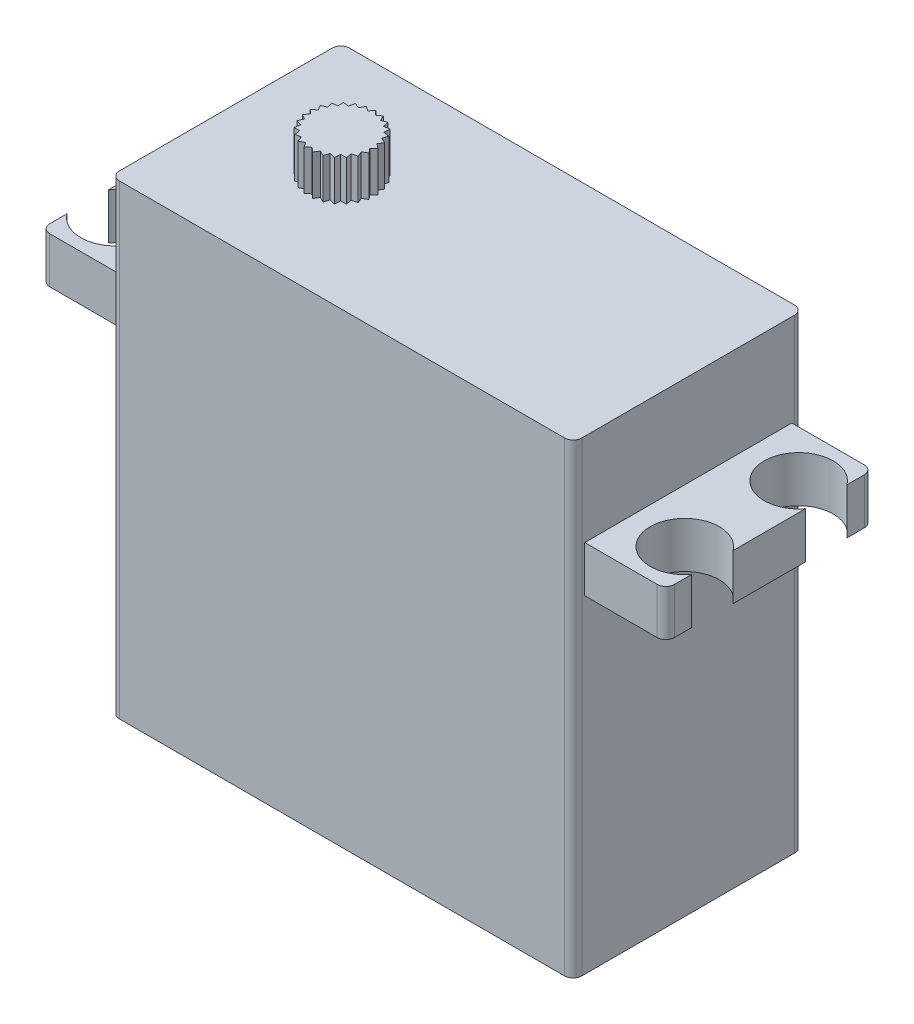
from build123d import *

# Parameters (mm, degrees)
SKETCH1_W           = 40.2
SKETCH1_H           = 20
BOSS_EXTRUDE1_DEPTH = 40.5
SKETCH2_W           = 18
SKETCH2_H           = 2
BOSS_EXTRUDE2_DEPTH = 7.05
SKETCH5_R           = 3
CUT_EXTRUDE1_DEPTH  = 7.05
MIRROR2_START       = 28.5
MIRROR2_DEPTH       = 4
FILLET2_R           = 0.75
BOSS_EXTRUDE3_DEPTH = 3.5


# Read off the part's stored shape, not the designer's step: Mirror2
with BuildPart() as part:
    # Sketch1 → Boss-Extrude1 (new body)
    with BuildSketch(Plane(origin=(0, 0, 0), x_dir=(1, 0, 0), z_dir=(0, 1, 0))):
        Rectangle(SKETCH1_W, SKETCH1_H)
    extrude(amount=BOSS_EXTRUDE1_DEPTH)

    # Sketch2 → Boss-Extrude2 (add)
    with BuildSketch(Plane(origin=(20.1, 0, 0), x_dir=(0, 0, -1), z_dir=(1, 0, 0))):
        with Locations((0, 29.5)):
            Rectangle(SKETCH2_W, SKETCH2_H)
    extrude(amount=BOSS_EXTRUDE2_DEPTH)

    # Sketch5 → Cut-Extrude1 (cut)
    with BuildSketch(Plane(origin=(0, 30.5, 0), x_dir=(1, 0, 0), z_dir=(0, 1, 0))):
        with Locations((24.75, 4.95)):
            Circle(SKETCH5_R)
        with Locations((24.75, -4.95)):
            Circle(SKETCH5_R)
    extrude(amount=-CUT_EXTRUDE1_DEPTH, mode=Mode.SUBTRACT)

    # Mirror2 outline → Mirror2 (add)
    with BuildSketch(Plane(origin=(0, 0, 0), x_dir=(1, 0, 0), z_dir=(0, 1, 0)).offset(MIRROR2_START)):
        with BuildLine():
            Line((-27.15, 3.15), (-27.15, -3.15))
            ThreePointArc((-27.15, -3.15), (-21.75, -4.95), (-27.15, -6.75))
            Line((-27.15, -6.75), (-27.15, -9))
            Line((-27.15, -9), (-20.1, -9))
            Line((-20.1, -9), (-20.1, 9))
            Line((-20.1, 9), (-27.15, 9))
            Line((-27.15, 9), (-27.15, 6.75))
            ThreePointArc((-27.15, 6.75), (-21.75, 4.95), (-27.15, 3.15))
        make_face()
        with BuildLine():
            Line((27.15, 6.75), (27.15, 9))
            Line((27.15, 9), (20.1, 9))
            Line((20.1, 9), (20.1, -9))
            Line((20.1, -9), (27.15, -9))
            Line((27.15, -9), (27.15, -6.75))
            ThreePointArc((27.15, -6.75), (21.75, -4.95), (27.15, -3.15))
            Line((27.15, -3.15), (27.15, 3.15))
            ThreePointArc((27.15, 3.15), (21.75, 4.95), (27.15, 6.75))
        make_face()
    extrude(amount=MIRROR2_DEPTH)

    # Fillet2
    fillet2_edges = [part.edges().sort_by_distance(p)[0] for p in [
        (27.15, 30.5, 9),
        (27.15, 30.5, -9),
        (-27.15, 30.5, 9),
        (-27.15, 30.5, -9),
        (20.1, 20.25, 10),
        (-20.1, 20.25, 10),
        (-20.1, 20.25, -10),
        (20.1, 20.25, -10),
    ]]
    fillet(fillet2_edges, radius=FILLET2_R)

    # Sketch6 → Boss-Extrude3 (add)
    with BuildSketch(Plane(origin=(0, 40.5, 0), x_dir=(1, 0, 0), z_dir=(0, 1, 0))):
        Polygon((-9.266364833, 2.857320325), (-9.046549886, 2.408140097), (-8.578826661, 2.585104706), (-8.477624186, 2.095370547), (-7.980586038, 2.150457451), (-8.004354957, 1.650941158), (-7.50923262, 1.580689045), (-7.656479445, 1.102777065), (-7.194383277, 0.911600133), (-7.455855949, 0.485321434), (-7.055821151, 0.185232033), (-7.41509038, -0.162628729), (-7.10225261, -0.552774878), (-7.536744189, -0.80036033), (-7.330760195, -1.25604891), (-7.81317342, -1.387802348), (-7.726985934, -1.88040077), (-8.227009008, -1.888043641), (-8.266033506, -2.386600133), (-8.75224814, -2.269652207), (-8.91403257, -2.742840633), (-9.355888111, -2.508650179), (-9.630266961, -2.926738369), (-10, -2.590020434), (-10.369733039, -2.926738369), (-10.644111889, -2.508650179), (-11.08596743, -2.742840633), (-11.24775186, -2.269652207), (-11.733966494, -2.386600133), (-11.772990992, -1.888043641), (-12.273014066, -1.88040077), (-12.18682658, -1.387802348), (-12.669239805, -1.25604891), (-12.463255811, -0.80036033), (-12.89774739, -0.552774878), (-12.58490962, -0.162628729), (-12.944178849, 0.185232033), (-12.544144051, 0.485321434), (-12.805616723, 0.911600133), (-12.343520555, 1.102777065), (-12.49076738, 1.580689045), (-11.995645043, 1.650941158), (-12.019413962, 2.150457451), (-11.522375814, 2.095370547), (-11.421173339, 2.585104706), (-10.953450114, 2.408140097), (-10.733635167, 2.857320325), (-10.324615636, 2.569597349), (-10, 2.95), (-9.675384364, 2.569597349), align=None)
    extrude(amount=BOSS_EXTRUDE3_DEPTH)


solid = part.part
